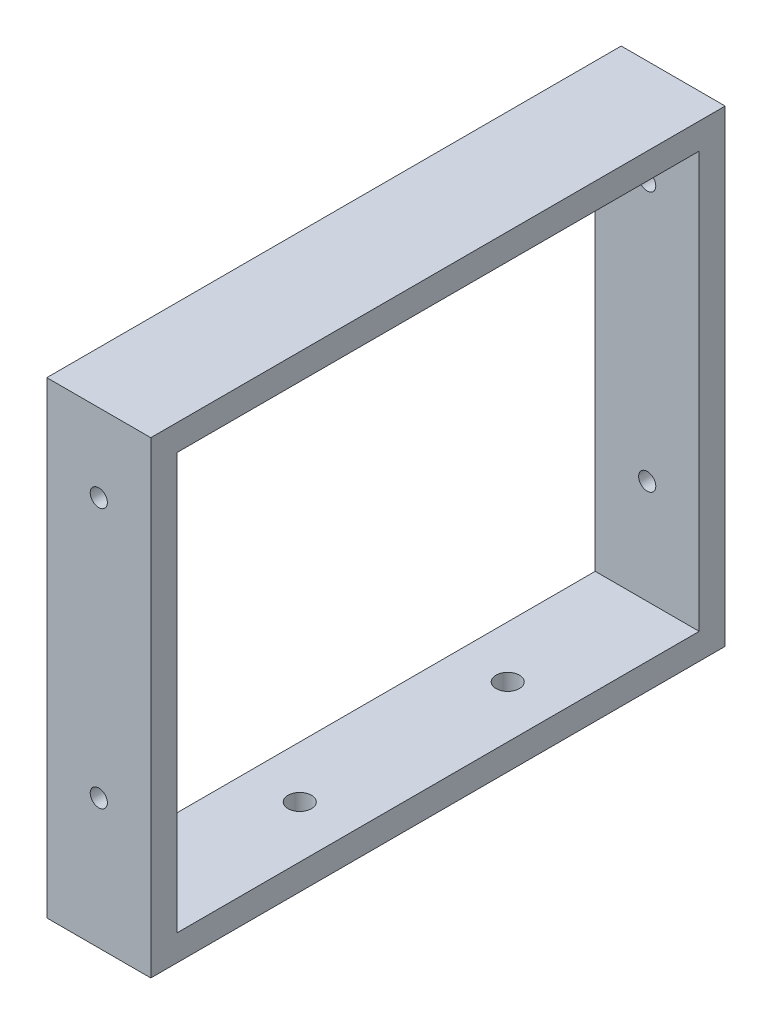
from build123d import *

# Parameters (mm, degrees)
SKETCH1_W                      = 110.475
SKETCH1_H                      = 90
SKETCH1_W_2                    = 70.475
SKETCH1_H_2                    = 80
SKETCH1_W_3                    = 25
BOSS_EXTRUDE1_DEPTH            = 20
M4_CLEARANCE_HOLE1_AT_2_COUNT  = 2
M4_CLEARANCE_HOLE1_AT_2_PITCH  = 40
M4X0_7_TAPPED_HOLE1_AT_2_COUNT = 2
M4X0_7_TAPPED_HOLE1_AT_2_PITCH = 50
SKETCH7_W                      = 5
SKETCH7_H                      = 80
CUT_EXTRUDE1_DEPTH             = 30


with BuildPart() as part:
    # Sketch1 → Boss-Extrude1 (new body)
    with BuildSketch(Plane(origin=(0, 0, 0), x_dir=(0, 0, -1), z_dir=(1, 0, 0))):
        Rectangle(SKETCH1_W, SKETCH1_H)
        with Locations((-15, 0)):
            Rectangle(SKETCH1_W_2, SKETCH1_H_2, mode=Mode.SUBTRACT)
        with Locations((37.7375, 0)):
            Rectangle(SKETCH1_W_3, SKETCH1_H_2, mode=Mode.SUBTRACT)
    extrude(amount=BOSS_EXTRUDE1_DEPTH)

    # Sketch3 → M4 Clearance Hole1 (revolve, cut)
    with BuildSketch(Plane(origin=(10, -40, -23.4125), x_dir=(0, 0, 1), z_dir=(1, 0, 0))):
        Polygon((0, 0), (0, 9.151936393), (2.25, 7.8), (2.25, 0), align=None)
    m4_clearance_hole1 = revolve(axis=Axis((10, -33.65, -23.4125), (0, -1, 0)), mode=Mode.SUBTRACT)

    # M4 Clearance Hole1 at 2: M4 Clearance Hole1 ×2
    with Locations(*[(0, 0, i * M4_CLEARANCE_HOLE1_AT_2_PITCH) for i in range(1, M4_CLEARANCE_HOLE1_AT_2_COUNT)]):
        add(m4_clearance_hole1, mode=Mode.SUBTRACT)

    # Sketch6 → M4x0.7 Tapped Hole1 (revolve, cut)
    with BuildSketch(Plane(origin=(10, 30, 55.2375), x_dir=(0, -1, 0), z_dir=(1, 0, 0))):
        Polygon((0, 0), (0, 11.091420021), (1.65, 10.1), (1.65, 0), align=None)
    m4x0_7_tapped_hole1 = revolve(axis=Axis((10, 30, 61.5875), (0, 0, -1)), mode=Mode.SUBTRACT)

    # M4x0.7 Tapped Hole1 at 2: M4x0.7 Tapped Hole1 ×2
    with Locations(*[(0, -i * M4X0_7_TAPPED_HOLE1_AT_2_PITCH, 0) for i in range(1, M4X0_7_TAPPED_HOLE1_AT_2_COUNT)]):
        add(m4x0_7_tapped_hole1, mode=Mode.SUBTRACT)

    # Mirror1: M4x0.7 Tapped Hole1 across plane
    add(m4x0_7_tapped_hole1.mirror(Plane.XY), mode=Mode.SUBTRACT)

    # Mirror1 copy 1 sketch → Mirror1 copy 1 (revolve, cut)
    with BuildSketch(Plane(origin=(10, -20, -55.2375), x_dir=(0, -1, 0), z_dir=(1, 0, 0))):
        Polygon((0, 0), (0, -11.091420021), (1.65, -10.1), (1.65, 0), align=None)
    revolve(axis=Axis((10, -20, -61.5875), (0, 0, -1)), mode=Mode.SUBTRACT)

    # Sketch7 → Cut-Extrude1 (cut)
    with BuildSketch(Plane.ZY):
        with Locations((-22.7375, 0)):
            Rectangle(SKETCH7_W, SKETCH7_H)
    extrude(amount=-CUT_EXTRUDE1_DEPTH, mode=Mode.SUBTRACT)


solid = part.part
